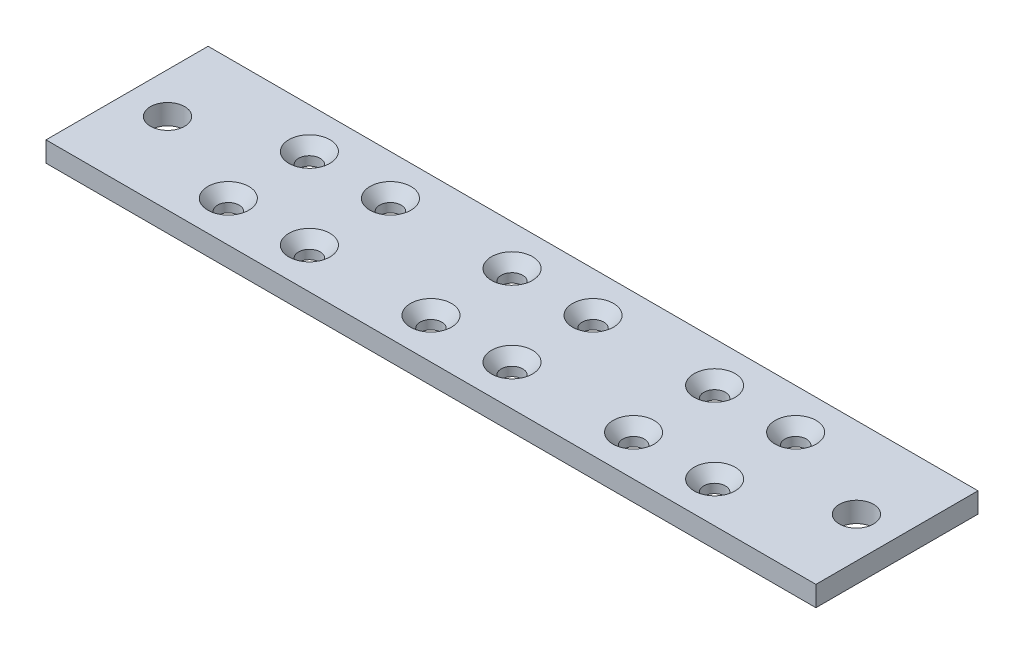
from build123d import *

# Parameters (mm, degrees)
SKETCH1_W               = 241.3
SKETCH1_H               = 50.8
BOSS_EXTRUDE1_DEPTH     = 6.35
F_1_2_13_TAPPED_HOLE1_D = 10.71626


# Read off the part's stored shape, not the designer's step: CSK for 1/4 Flat Head Machine Screw1
with BuildPart() as part:
    # Sketch1 → Boss-Extrude1 (new body)
    with BuildSketch(Plane(origin=(0, 0, 0), x_dir=(1, 0, 0), z_dir=(0, 1, 0))):
        Rectangle(SKETCH1_W, SKETCH1_H)
    extrude(amount=BOSS_EXTRUDE1_DEPTH)

    # CSK for 1/4 Flat Head Machine Screw1 out → CSK for 1/4 Flat Head Machine Screw1 (revolve, cut)
    with BuildSketch(Plane(origin=(76.2, 0, 12.7), x_dir=(1, 0, 0), z_dir=(0, 0, 1))):
        Polygon((0, 0), (3.3782, 0), (3.3782, 2.829067416), (6.4389, 6.35), (0, 6.35), align=None)
    revolve(axis=Axis((76.2, 0, 12.7), (0, 1, 0)), mode=Mode.SUBTRACT)

    # CSK for 1_4 Flat Head Machine Screw1 2 o → CSK for 1_4 Flat Head Machine Screw1 2 (revolve, cut)
    with BuildSketch(Plane(origin=(50.8, 0, -12.7), x_dir=(1, 0, 0), z_dir=(0, 0, 1))):
        Polygon((0, 0), (3.3782, 0), (3.3782, 2.829067416), (6.4389, 6.35), (0, 6.35), align=None)
    revolve(axis=Axis((50.8, 0, -12.7), (0, 1, 0)), mode=Mode.SUBTRACT)

    # CSK for 1_4 Flat Head Machine Screw1 3 o → CSK for 1_4 Flat Head Machine Screw1 3 (revolve, cut)
    with BuildSketch(Plane(origin=(50.8, 0, 12.7), x_dir=(1, 0, 0), z_dir=(0, 0, 1))):
        Polygon((0, 0), (3.3782, 0), (3.3782, 2.829067416), (6.4389, 6.35), (0, 6.35), align=None)
    revolve(axis=Axis((50.8, 0, 12.7), (0, 1, 0)), mode=Mode.SUBTRACT)

    # CSK for 1_4 Flat Head Machine Screw1 4 o → CSK for 1_4 Flat Head Machine Screw1 4 (revolve, cut)
    with BuildSketch(Plane(origin=(76.2, 0, -12.7), x_dir=(1, 0, 0), z_dir=(0, 0, 1))):
        Polygon((0, 0), (3.3782, 0), (3.3782, 2.829067416), (6.4389, 6.35), (0, 6.35), align=None)
    revolve(axis=Axis((76.2, 0, -12.7), (0, 1, 0)), mode=Mode.SUBTRACT)

    # CSK for 1_4 Flat Head Machine Screw1 5 o → CSK for 1_4 Flat Head Machine Screw1 5 (revolve, cut)
    with BuildSketch(Plane(origin=(-50.8, 0, 12.7), x_dir=(1, 0, 0), z_dir=(0, 0, 1))):
        Polygon((0, 0), (3.3782, 0), (3.3782, 2.829067416), (6.4389, 6.35), (0, 6.35), align=None)
    revolve(axis=Axis((-50.8, 0, 12.7), (0, 1, 0)), mode=Mode.SUBTRACT)

    # CSK for 1_4 Flat Head Machine Screw1 6 o → CSK for 1_4 Flat Head Machine Screw1 6 (revolve, cut)
    with BuildSketch(Plane(origin=(-76.2, 0, -12.7), x_dir=(1, 0, 0), z_dir=(0, 0, 1))):
        Polygon((0, 0), (3.3782, 0), (3.3782, 2.829067416), (6.4389, 6.35), (0, 6.35), align=None)
    revolve(axis=Axis((-76.2, 0, -12.7), (0, 1, 0)), mode=Mode.SUBTRACT)

    # CSK for 1_4 Flat Head Machine Screw1 7 o → CSK for 1_4 Flat Head Machine Screw1 7 (revolve, cut)
    with BuildSketch(Plane(origin=(-76.2, 0, 12.7), x_dir=(1, 0, 0), z_dir=(0, 0, 1))):
        Polygon((0, 0), (3.3782, 0), (3.3782, 2.829067416), (6.4389, 6.35), (0, 6.35), align=None)
    revolve(axis=Axis((-76.2, 0, 12.7), (0, 1, 0)), mode=Mode.SUBTRACT)

    # CSK for 1_4 Flat Head Machine Screw1 8 o → CSK for 1_4 Flat Head Machine Screw1 8 (revolve, cut)
    with BuildSketch(Plane(origin=(-50.8, 0, -12.7), x_dir=(1, 0, 0), z_dir=(0, 0, 1))):
        Polygon((0, 0), (3.3782, 0), (3.3782, 2.829067416), (6.4389, 6.35), (0, 6.35), align=None)
    revolve(axis=Axis((-50.8, 0, -12.7), (0, 1, 0)), mode=Mode.SUBTRACT)

    # CSK for 1_4 Flat Head Machine Screw1 9 o → CSK for 1_4 Flat Head Machine Screw1 9 (revolve, cut)
    with BuildSketch(Plane(origin=(12.7, 0, 12.7), x_dir=(1, 0, 0), z_dir=(0, 0, 1))):
        Polygon((0, 0), (3.3782, 0), (3.3782, 2.829067416), (6.4389, 6.35), (0, 6.35), align=None)
    revolve(axis=Axis((12.7, 0, 12.7), (0, 1, 0)), mode=Mode.SUBTRACT)

    # CSK for 1_4 Flat Head Machine Screw1 11 → CSK for 1_4 Flat Head Machine Screw1 10 (revolve, cut)
    with BuildSketch(Plane(origin=(-12.7, 0, -12.7), x_dir=(1, 0, 0), z_dir=(0, 0, 1))):
        Polygon((0, 0), (3.3782, 0), (3.3782, 2.829067416), (6.4389, 6.35), (0, 6.35), align=None)
    revolve(axis=Axis((-12.7, 0, -12.7), (0, 1, 0)), mode=Mode.SUBTRACT)

    # CSK for 1_4 Flat Head Machine Screw1 13 → CSK for 1_4 Flat Head Machine Screw1 12 (revolve, cut)
    with BuildSketch(Plane(origin=(-12.7, 0, 12.7), x_dir=(1, 0, 0), z_dir=(0, 0, 1))):
        Polygon((0, 0), (3.3782, 0), (3.3782, 2.829067416), (6.4389, 6.35), (0, 6.35), align=None)
    revolve(axis=Axis((-12.7, 0, 12.7), (0, 1, 0)), mode=Mode.SUBTRACT)

    # CSK for 1_4 Flat Head Machine Screw1 15 → CSK for 1_4 Flat Head Machine Screw1 14 (revolve, cut)
    with BuildSketch(Plane(origin=(12.7, 0, -12.7), x_dir=(1, 0, 0), z_dir=(0, 0, 1))):
        Polygon((0, 0), (3.3782, 0), (3.3782, 2.829067416), (6.4389, 6.35), (0, 6.35), align=None)
    revolve(axis=Axis((12.7, 0, -12.7), (0, 1, 0)), mode=Mode.SUBTRACT)

    # 1/2-13 Tapped Hole1 (through all)
    with Locations(Plane(origin=(0, 6.35, 0), x_dir=(1, 0, 0), z_dir=(0, 1, 0))):
        with Locations((-107.95, 0), (107.95, 0)):
            Hole(F_1_2_13_TAPPED_HOLE1_D / 2)


solid = part.part
